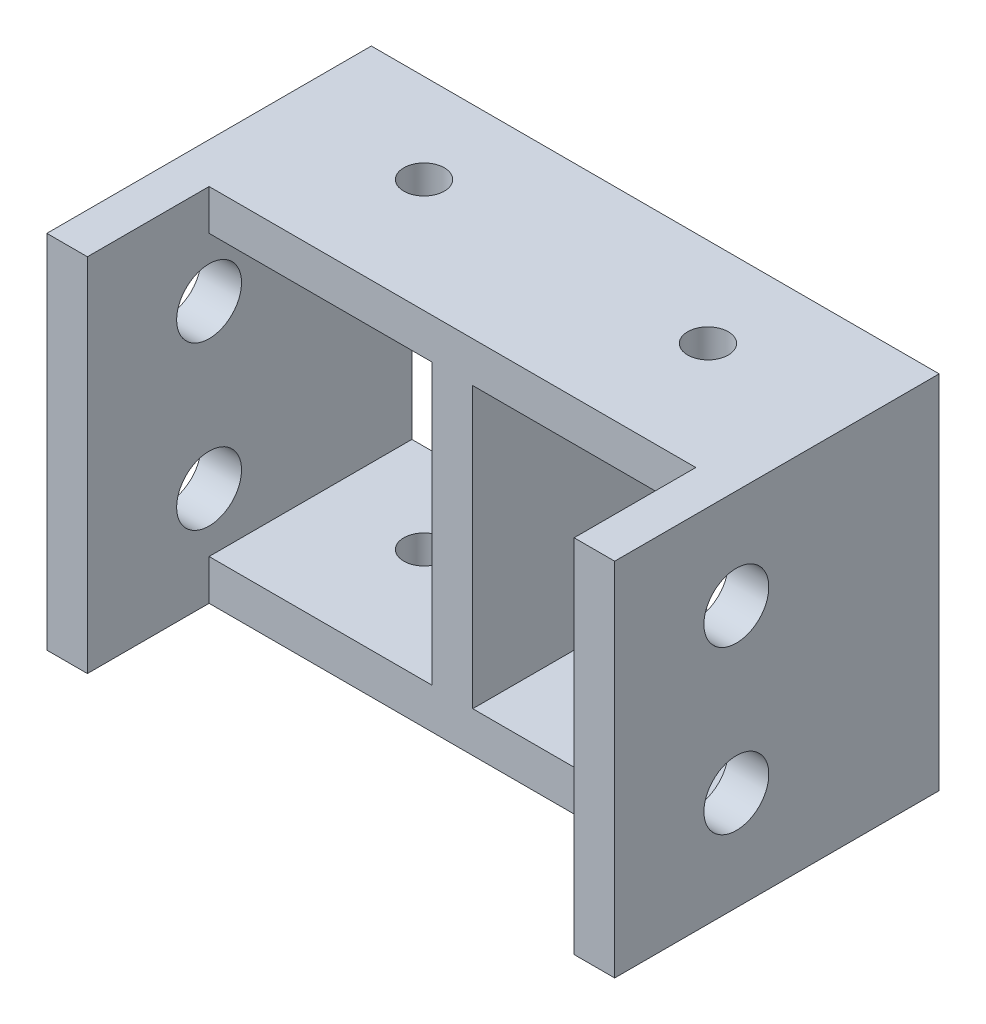
from build123d import *
from build123d.topology import SkipClean

# Parameters (mm, degrees)
SKETCH2_W               = 140
SKETCH2_H               = 89
SKETCH2_W_2             = 55
SKETCH2_H_2             = 69
BOSS_EXTRUDE2_DEPTH     = 50
CUT_EXTRUDE1_DEPTH      = 124.778027129
CUT_EXTRUDE1_DEPTH_BACK = 124.778027129
SKETCH3_R               = 5
SKETCH4_R               = 8
CUT_EXTRUDE2_DEPTH      = 15
SKETCH5_W               = 10
SKETCH5_H               = 89
BOSS_EXTRUDE4_DEPTH     = 30
SKETCH4_5_R             = 8
CUT_EXTRUDE5_DEPTH      = 30
MIRROR5_START           = 60
MIRROR5_DEPTH           = 10


# Read off the part's stored shape, not the designer's step: Mirror5
with BuildPart() as part:
    # Sketch2 → Boss-Extrude2 (new body)
    with BuildSketch(Plane.XY):
        with Locations((0, -0.480959067)):
            Rectangle(SKETCH2_W, SKETCH2_H)
        with Locations((32.5, -0.480959067)):
            Rectangle(SKETCH2_W_2, SKETCH2_H_2, mode=Mode.SUBTRACT)
        with Locations((-32.5, -0.480959067)):
            Rectangle(SKETCH2_W_2, SKETCH2_H_2, mode=Mode.SUBTRACT)
    extrude(amount=BOSS_EXTRUDE2_DEPTH)

    # Sketch3 → Cut-Extrude1 (cut, two sides: drawn at the far end of the back side and taken through both)
    with BuildSketch(Plane.XZ.offset(44.980959067).offset(-CUT_EXTRUDE1_DEPTH_BACK)):
        with Locations(Location((-35, 22, 0), (0, 0, 270))):
            Circle(SKETCH3_R)
        with Locations(Location((35, 22, 0), (0, 0, 270))):
            Circle(SKETCH3_R)
    extrude(amount=CUT_EXTRUDE1_DEPTH + CUT_EXTRUDE1_DEPTH_BACK, mode=Mode.SUBTRACT)

    # Sketch4 → Cut-Extrude2 (cut)
    with BuildSketch(Plane.ZY.offset(70)):
        with Locations((50, 19.519040933)):
            Circle(SKETCH4_R)
        with Locations((50, -20.480959067)):
            Circle(SKETCH4_R)
    cut_extrude2 = extrude(amount=-CUT_EXTRUDE2_DEPTH, mode=Mode.SUBTRACT)

    # Mirror1: Cut-Extrude2 across plane
    add(cut_extrude2.mirror(Plane(origin=(0, 0, 0), x_dir=(0, 0, 1), z_dir=(1, 0, 0))), mode=Mode.SUBTRACT)

    # Sketch5 → Boss-Extrude4 (add)
    with BuildSketch(Plane.XY.offset(50)):
        with Locations((-65, -0.480959067)):
            Rectangle(SKETCH5_W, SKETCH5_H)
    extrude(amount=BOSS_EXTRUDE4_DEPTH)

    # Sketch4<5> → Cut-Extrude5 (cut)
    with BuildSketch(Plane.ZY.offset(70)):
        with Locations((50, 19.519040933)):
            Circle(SKETCH4_5_R)
        with Locations((50, -20.480959067)):
            Circle(SKETCH4_5_R)
    extrude(amount=-CUT_EXTRUDE5_DEPTH, mode=Mode.SUBTRACT)

    # Mirror5 outline → Mirror5 (add)
    with SkipClean():  # the faces are left unmerged after this step: merging them gives an invalid solid
        with BuildSketch(Plane.YZ.offset(MIRROR5_START)):
            with BuildLine():
                ThreePointArc((-28.480959067, 50), (-20.480959067, 58), (-12.480959067, 50))
                Line((-12.480959067, 50), (11.519040933, 50))
                ThreePointArc((11.519040933, 50), (19.519040933, 58), (27.519040933, 50))
                Line((27.519040933, 50), (44.019040933, 50))
                Line((44.019040933, 50), (44.019040933, 80))
                Line((44.019040933, 80), (-44.980959067, 80))
                Line((-44.980959067, 80), (-44.980959067, 50))
                Line((-44.980959067, 50), (-28.480959067, 50))
            make_face()
        extrude(amount=MIRROR5_DEPTH)
    add(part.part.scale(1), mode=Mode.REPLACE)  # the faces are merged on a copy


solid = part.part
